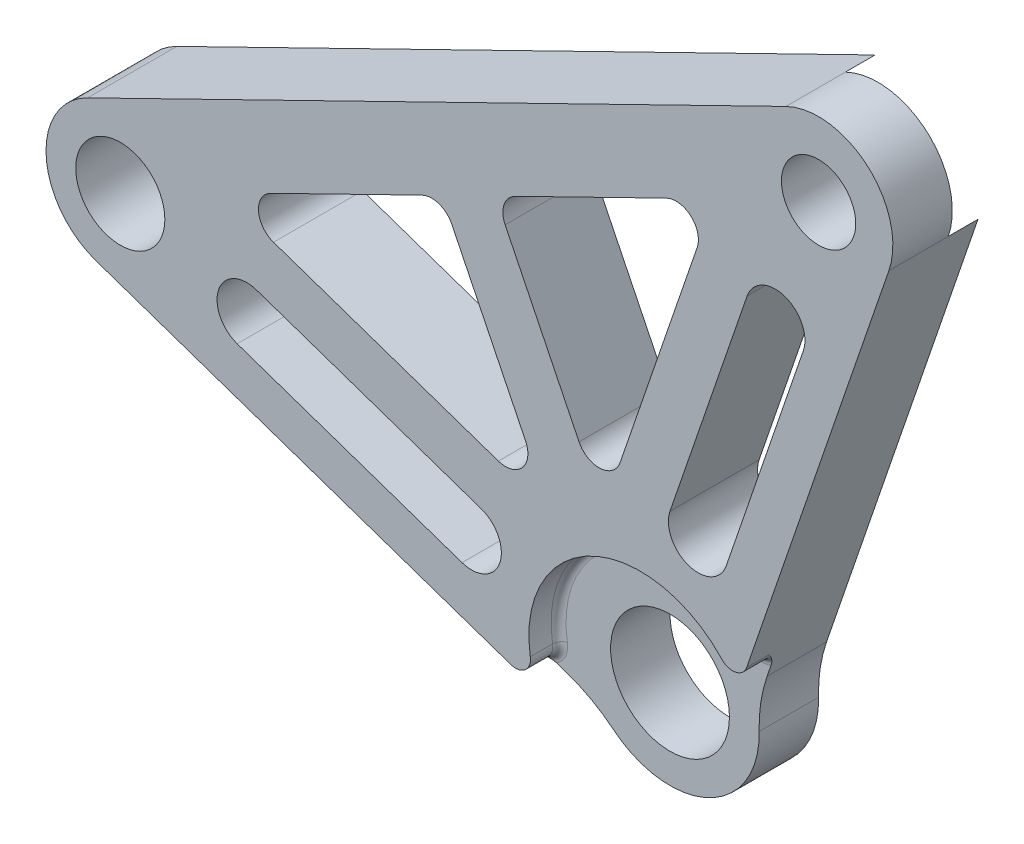
from build123d import *

# Parameters (mm, degrees)
SKETCH1_R               = 3
SKETCH1_R_2             = 4
SKETCH1_R_3             = 2.5
BOSS_EXTRUDE1_DEPTH     = 6
CUT_EXTRUDE1_DEPTH      = 57.885850613
CUT_EXTRUDE1_DEPTH_BACK = 57.885850613
SKETCH4_R               = 7.5
CUT_EXTRUDE2_DEPTH      = 2
FILLET1_R               = 1
FILLET2_R               = 0.5
SKETCH5_R               = 5
CUT_EXTRUDE4_DEPTH      = 2


with BuildPart() as part:
    # Sketch1 → Boss-Extrude1 (new body)
    with BuildSketch(Plane.XY):
        with BuildLine():
            Line((16.72972973, 33.378378378), (6.535491145, 3.645182505))
            ThreePointArc((6.535491145, 3.645182505), (6.111138498, 1.921892634), (5.998106477, 0.150727223))
            ThreePointArc((5.998106477, 0.150727223), (2.637317184, -5.389300332), (-3.799375872, -4.643785415))
            ThreePointArc((-3.799375872, -4.643785415), (-5.267291655, -3.646275313), (-6.888425749, -2.923968315))
            Line((-6.888425749, -2.923968315), (-36.621621622, 7.27027027))
            ThreePointArc((-36.621621622, 7.27027027), (-39.99026822, 11.688193819), (-37.19776432, 16.49108361))
            Line((-37.19776432, 16.49108361), (9.80223568, 39.49108361))
            ThreePointArc((9.80223568, 39.49108361), (15.308172233, 38.749132763), (16.72972973, 33.378378378))
        make_face()
        with Locations((-35, 12)):
            Circle(SKETCH1_R, mode=Mode.SUBTRACT)
        Circle(SKETCH1_R_2, mode=Mode.SUBTRACT)
        with Locations((12, 35)):
            Circle(SKETCH1_R_3, mode=Mode.SUBTRACT)
    extrude(amount=BOSS_EXTRUDE1_DEPTH)

    # Sketch2 → Cut-Extrude1 (cut, two sides: drawn at the far end of the back side and taken through both)
    with BuildSketch(Plane.XY.offset(6).offset(-CUT_EXTRUDE1_DEPTH_BACK)):
        with BuildLine():
            Line((-24.859247394, 17.097563964), (-14.697085232, 22.070536937))
            ThreePointArc((-14.697085232, 22.070536937), (-13.551269449, 22.142130773), (-12.690430853, 21.38254115))
            Line((-12.690430853, 21.38254115), (-7.71745788, 11.220378988))
            ThreePointArc((-7.71745788, 11.220378988), (-7.940043134, 9.568598022), (-9.551269449, 9.142130773))
            Line((-9.551269449, 9.142130773), (-24.686404584, 14.331319962))
            ThreePointArc((-24.686404584, 14.331319962), (-25.696998564, 15.656697027), (-24.859247394, 17.097563964))
        make_face()
        with BuildLine():
            Line((-25.837837838, 10.972972973), (-10.702702703, 5.783783784))
            ThreePointArc((-10.702702703, 5.783783784), (-9.459459459, 3.243243243), (-12, 2))
            Line((-12, 2), (-27.135135135, 7.189189189))
            ThreePointArc((-27.135135135, 7.189189189), (-28.378378378, 9.72972973), (-25.837837838, 10.972972973))
        make_face()
        with BuildLine():
            Line((-9.097563964, 23.140752606), (-4.124590991, 12.978590444))
            ThreePointArc((-4.124590991, 12.978590444), (-2.683724054, 12.140839274), (-1.358346989, 13.151433254))
            Line((-1.358346989, 13.151433254), (3.8308422, 28.286568389))
            ThreePointArc((3.8308422, 28.286568389), (3.404374951, 29.897794704), (1.752593985, 30.120379958))
            Line((1.752593985, 30.120379958), (-8.409568177, 25.147406985))
            ThreePointArc((-8.409568177, 25.147406985), (-9.1691578, 24.286568389), (-9.097563964, 23.140752606))
        make_face()
        with BuildLine():
            Line((7.189189189, 27.135135135), (2, 12))
            ThreePointArc((2, 12), (3.243243243, 9.459459459), (5.783783784, 10.702702703))
            Line((5.783783784, 10.702702703), (10.972972973, 25.837837838))
            ThreePointArc((10.972972973, 25.837837838), (9.72972973, 28.378378378), (7.189189189, 27.135135135))
        make_face()
    extrude(amount=CUT_EXTRUDE1_DEPTH + CUT_EXTRUDE1_DEPTH_BACK, mode=Mode.SUBTRACT)

    # Sketch4 → Cut-Extrude2 (cut)
    with BuildSketch(Plane.XY.offset(6)):
        Circle(SKETCH4_R)
    extrude(amount=-CUT_EXTRUDE2_DEPTH, mode=Mode.SUBTRACT)

    # Fillet1
    fillet1_edges = [part.edges().sort_by_distance(p)[0] for p in [
        (6.54275782, 3.666376974, 5),
        (-6.909620217, -2.91670164, 5),
    ]]
    fillet(fillet1_edges, radius=FILLET1_R)

    # Fillet2
    # the kernel refuses this fillet: 0.5 mm, written as the material it adds along each edge
    with BuildSketch(Plane(origin=(0, 0, 4), x_dir=(0.7313195548489669, 0.6820349761526229, 0), z_dir=(0.6820349761526229, -0.7313195548489669, 0))) as fillet2_piece_1:
        with BuildLine():
            CenterArc((7.5 - FILLET2_R, FILLET2_R), FILLET2_R, 270, 90)
            Line((7.5 - FILLET2_R, 0), (7.5, 0))
            Line((7.5, 0), (7.5, FILLET2_R))
        make_face()
    revolve(axis=Axis((0, 0, 4), (0, 0, 1)), revolution_arc=146.144973872)
    with BuildSketch(Plane(origin=(6.216216216, 5.797297297, 4), x_dir=(0.6053689071166585, 0.7959450271823945, 0), z_dir=(-0.7959450271823945, 0.6053689071166585, 0))) as fillet2_piece_2_section:
        with BuildLine():
            CenterArc((1 + FILLET2_R, -FILLET2_R), FILLET2_R, 90, 90)
            Line((1, -FILLET2_R), (1, 0))
            Line((1, 0), (1 + FILLET2_R, 0))
        make_face()
    fillet2_piece_2 = revolve(axis=Axis((6.216216216, 5.797297297, 4), (0, 0, -1)), revolution_arc=189.741738526, mode=Mode.PRIVATE)
    fillet2_piece_2 = split(fillet2_piece_2, bisect_by=Plane(origin=(6.878990216, 4.647054795, 4.123474389), z_dir=(-0.945945945945946, 0.32432432432432406, 0)), keep=Keep.TOP, mode=Mode.PRIVATE)
    add(fillet2_piece_2)
    with BuildSketch(Plane(origin=(-8.391891892, -1.351351351, 4), x_dir=(0.9872813990461049, 0.1589825119236894, 0), z_dir=(-0.1589825119236894, 0.9872813990461049, 0))) as fillet2_piece_3_section:
        with BuildLine():
            CenterArc((1 + FILLET2_R, -FILLET2_R), FILLET2_R, 90, 90)
            Line((1 + FILLET2_R, 0), (1, 0))
            Line((1, 0), (1, -FILLET2_R))
        make_face()
    fillet2_piece_3 = revolve(axis=Axis((-8.391891892, -1.351351351, 4), (0, 0, -1)), revolution_arc=189.741738526, mode=Mode.PRIVATE)
    fillet2_piece_3 = split(fillet2_piece_3, bisect_by=Plane(origin=(-7.890298213, -2.580469184, 4.123474408), z_dir=(0.3243243243243243, 0.9459459459459462, 0)), keep=Keep.TOP, mode=Mode.PRIVATE)
    add(fillet2_piece_3)

    # Sketch5 → Cut-Extrude4 (cut)
    with BuildSketch(Plane(origin=(0, 0, 0), x_dir=(-1, 0, 0), z_dir=(0, 0, -1))):
        with Locations((-12, 35)):
            Circle(SKETCH5_R)
    extrude(amount=-CUT_EXTRUDE4_DEPTH, mode=Mode.SUBTRACT)


solid = part.part
